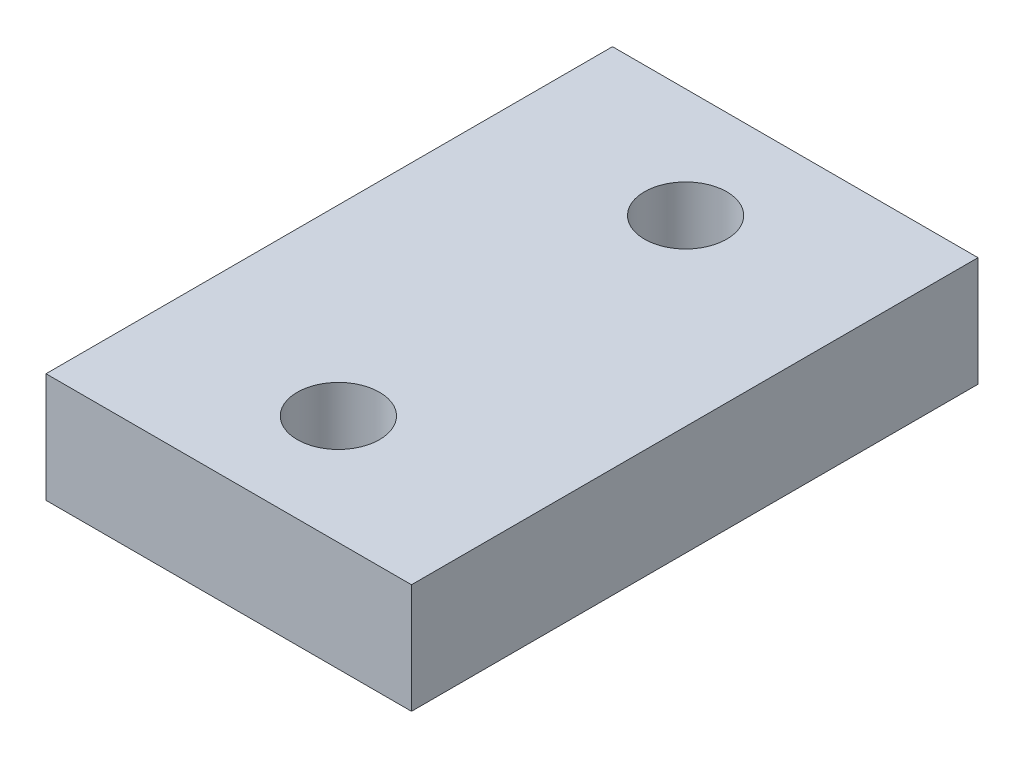
from build123d import *

# Parameters (mm, degrees)
SKETCH1_W           = 40
SKETCH1_H           = 62
BOSS_EXTRUDE1_DEPTH = 12


# Read off the part's stored shape, not the designer's step: AdvancedHole1
with BuildPart() as part:
    # Sketch1 → Boss-Extrude1 (new body)
    with BuildSketch(Plane(origin=(0, 0, 0), x_dir=(1, 0, 0), z_dir=(0, 1, 0))):
        Rectangle(SKETCH1_W, SKETCH1_H)
    extrude(amount=BOSS_EXTRUDE1_DEPTH)

    # AdvancedHole1 outline → AdvancedHole1 (revolve, cut)
    with BuildSketch(Plane.XY.offset(-19)):
        Polygon((4.5, 4.46), (4.5, 12), (0, 12), (0, 0), (8.96, 0), align=None)
    revolve(axis=Axis((0, 0, -19), (0, 1, 0)), mode=Mode.SUBTRACT)

    # AdvancedHole1 2 outline → AdvancedHole1 2 (revolve, cut)
    with BuildSketch(Plane.XY.offset(19)):
        Polygon((4.5, 4.46), (4.5, 12), (0, 12), (0, 0), (8.96, 0), align=None)
    revolve(axis=Axis((0, 0, 19), (0, 1, 0)), mode=Mode.SUBTRACT)


solid = part.part
